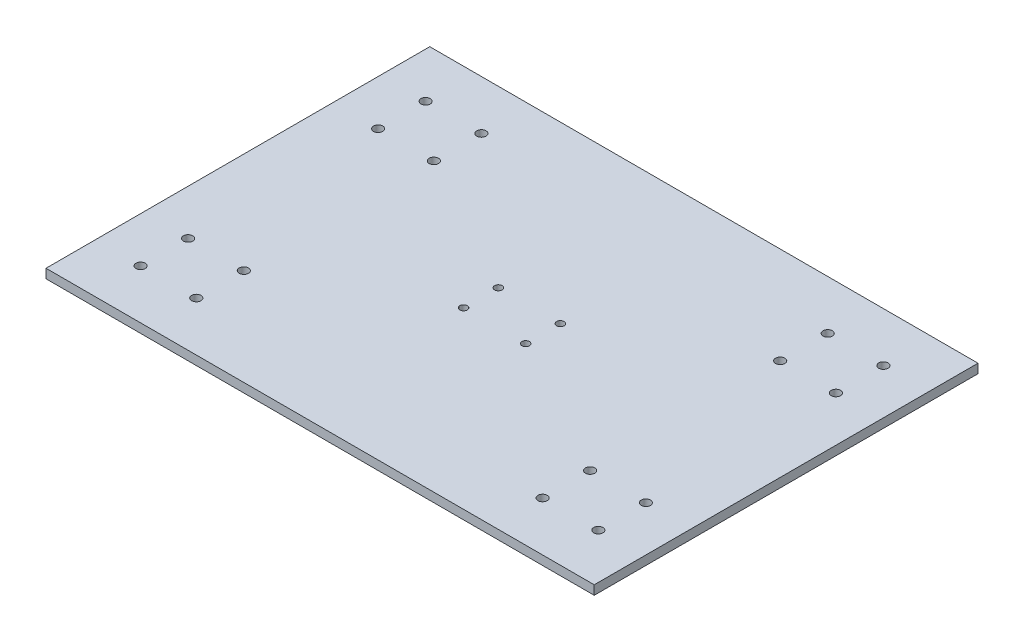
from build123d import *

# Parameters (mm, degrees)
SKETCH1_W           = 300
SKETCH1_H           = 210
BOSS_EXTRUDE1_DEPTH = 2.5
SKETCH2_R           = 2.55
CUT_EXTRUDE1_DEPTH  = 184.16659084
SKETCH3_R           = 2.05
CUT_EXTRUDE2_DEPTH  = 184.16659084


with BuildPart() as part:
    # Sketch1 → Boss-Extrude1 (new, symmetric)
    with BuildSketch(Plane(origin=(0, 0, 0), x_dir=(1, 0, 0), z_dir=(0, 1, 0))):
        Rectangle(SKETCH1_W, SKETCH1_H)
    extrude(amount=BOSS_EXTRUDE1_DEPTH, both=True)

    # Sketch2 → Cut-Extrude1 (cut, through all)
    with BuildSketch(Plane(origin=(0, 2.5, 0), x_dir=(1, 0, 0), z_dir=(0, 1, 0))):
        with Locations((-125.25, 78)):
            Circle(SKETCH2_R)
        with Locations((-125.25, 52)):
            Circle(SKETCH2_R)
        with Locations((-94.75, 78)):
            Circle(SKETCH2_R)
        with Locations((-94.75, 52)):
            Circle(SKETCH2_R)
        with Locations((-125.25, -52)):
            Circle(SKETCH2_R)
        with Locations((-125.25, -78)):
            Circle(SKETCH2_R)
        with Locations((-94.75, -78)):
            Circle(SKETCH2_R)
        with Locations((-94.75, -52)):
            Circle(SKETCH2_R)
        with Locations((125.25, -52)):
            Circle(SKETCH2_R)
        with Locations((94.75, -52)):
            Circle(SKETCH2_R)
        with Locations((94.75, -78)):
            Circle(SKETCH2_R)
        with Locations((125.25, -78)):
            Circle(SKETCH2_R)
        with Locations((94.75, 78)):
            Circle(SKETCH2_R)
        with Locations((94.75, 52)):
            Circle(SKETCH2_R)
        with Locations((125.25, 78)):
            Circle(SKETCH2_R)
        with Locations((125.25, 52)):
            Circle(SKETCH2_R)
    extrude(amount=-CUT_EXTRUDE1_DEPTH, mode=Mode.SUBTRACT)

    # Sketch3 → Cut-Extrude2 (cut, through all)
    with BuildSketch(Plane(origin=(0, 2.5, 0), x_dir=(1, 0, 0), z_dir=(0, 1, 0))):
        with Locations((-17, 9.5)):
            Circle(SKETCH3_R)
        with Locations((17, 9.5)):
            Circle(SKETCH3_R)
        with Locations((17, -9.5)):
            Circle(SKETCH3_R)
        with Locations((-17, -9.5)):
            Circle(SKETCH3_R)
    extrude(amount=-CUT_EXTRUDE2_DEPTH, mode=Mode.SUBTRACT)


solid = part.part
